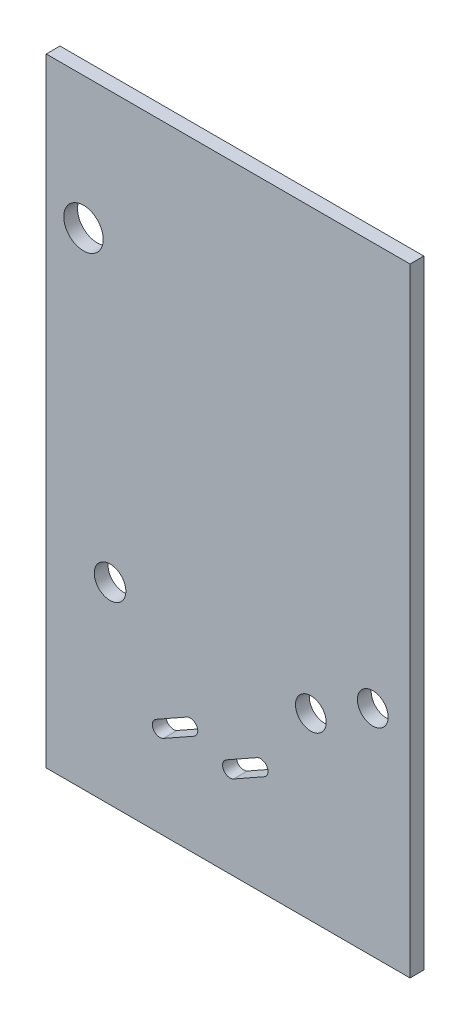
from build123d import *

# Parameters (mm, degrees)
SKETCH1_W           = 82.894272306
SKETCH1_H           = 140.894272306
SKETCH1_R           = 3.6
SKETCH1_R_2         = 3.5
SKETCH1_R_3         = 4.5
BOSS_EXTRUDE1_DEPTH = 3.14


with BuildPart() as part:
    # Sketch1 → Boss-Extrude1 (new body)
    with BuildSketch(Plane.XY):
        Rectangle(SKETCH1_W, SKETCH1_H)
        with BuildLine():
            ThreePointArc((-14.745996033, -51.265124074), (-17.044884469, -50.621435312), (-16.401195707, -48.322546875))
            Line((-16.401195707, -48.322546875), (-9.42859141, -44.400456958))
            ThreePointArc((-9.42859141, -44.400456958), (-7.129702973, -45.04414572), (-7.773391736, -47.343034157))
            Line((-7.773391736, -47.343034157), (-14.745996033, -51.265124074))
        make_face(mode=Mode.SUBTRACT)
        with Locations((-26.900831216, -26.517202566)):
            Circle(SKETCH1_R, mode=Mode.SUBTRACT)
        with BuildLine():
            ThreePointArc((1.254003967, -51.265124074), (-1.044884469, -50.621435312), (-0.401195707, -48.322546875))
            Line((-0.401195707, -48.322546875), (6.57140859, -44.400456958))
            ThreePointArc((6.57140859, -44.400456958), (8.870297027, -45.04414572), (8.226608264, -47.343034157))
            Line((8.226608264, -47.343034157), (1.254003967, -51.265124074))
        make_face(mode=Mode.SUBTRACT)
        with Locations((18.849494268, -29.546234455)):
            Circle(SKETCH1_R_2, mode=Mode.SUBTRACT)
        with Locations((32.960239, -21.476652312)):
            Circle(SKETCH1_R_2, mode=Mode.SUBTRACT)
        with Locations((-32.953932198, 40.341063425)):
            Circle(SKETCH1_R_3, mode=Mode.SUBTRACT)
    extrude(amount=BOSS_EXTRUDE1_DEPTH)


solid = part.part
